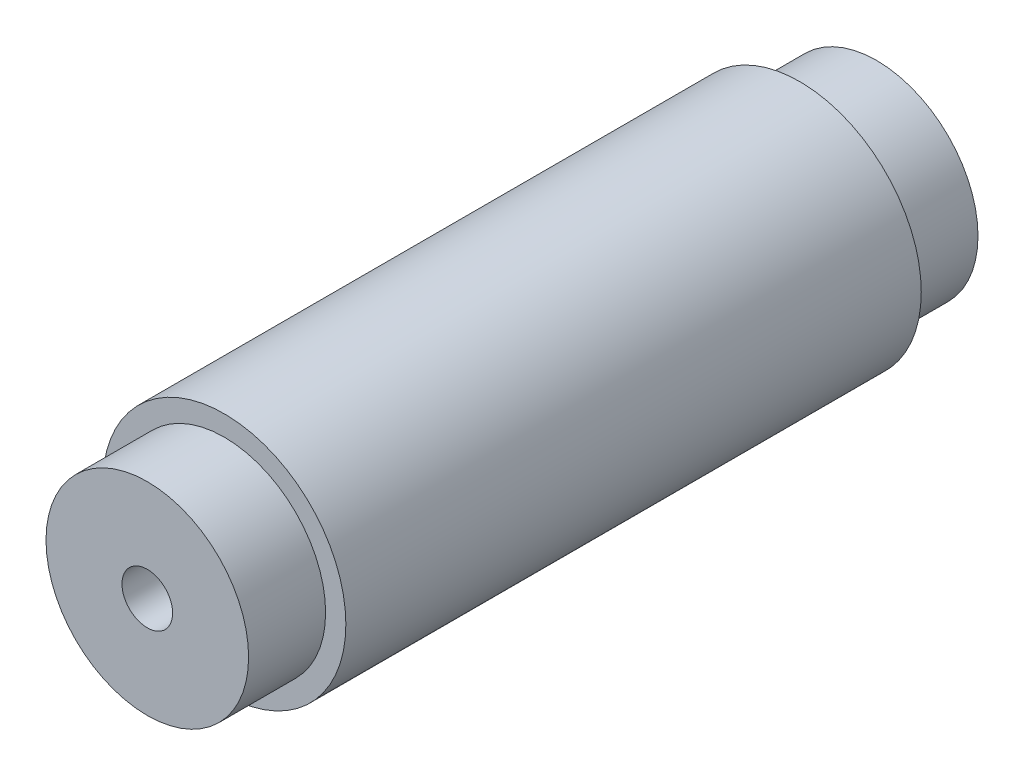
from build123d import *

# Parameters (mm, degrees)
SKETCH_1_R          = 6
EXTRUDE_1_DEPTH     = 36
CUT_EXTRUDE_START   = -3.8
SKETCH_2_R          = 6
SKETCH_2_R_2        = 5
CUT_EXTRUDE_1_DEPTH = 3.8
SKETCH_3_R          = 1.25
CUT_EXTRUDE_2_DEPTH = 10


with BuildPart() as part:
    # ｽｹｯﾁ1 → ﾎﾞｽ - 押し出し1 (new body)
    with BuildSketch(Plane.XY):
        Circle(SKETCH_1_R)
    extrude(amount=EXTRUDE_1_DEPTH)

    # ｽｹｯﾁ2 → ｶｯﾄ - 押し出し1 (cut)
    with BuildSketch(Plane.XY.offset(36).offset(CUT_EXTRUDE_START)):
        Circle(SKETCH_2_R)
        Circle(SKETCH_2_R_2, mode=Mode.SUBTRACT)
    cut_extrude_1 = extrude(amount=CUT_EXTRUDE_1_DEPTH, mode=Mode.SUBTRACT)

    # ｽｹｯﾁ3 → ｶｯﾄ - 押し出し2 (cut)
    with BuildSketch(Plane.XY.offset(36)):
        Circle(SKETCH_3_R)
    extrude(amount=-CUT_EXTRUDE_2_DEPTH, mode=Mode.SUBTRACT)

    # ﾐﾗｰ1: ｶｯﾄ - 押し出し1 across plane
    add(cut_extrude_1.mirror(Plane.XY.offset(18)), mode=Mode.SUBTRACT)


solid = part.part
